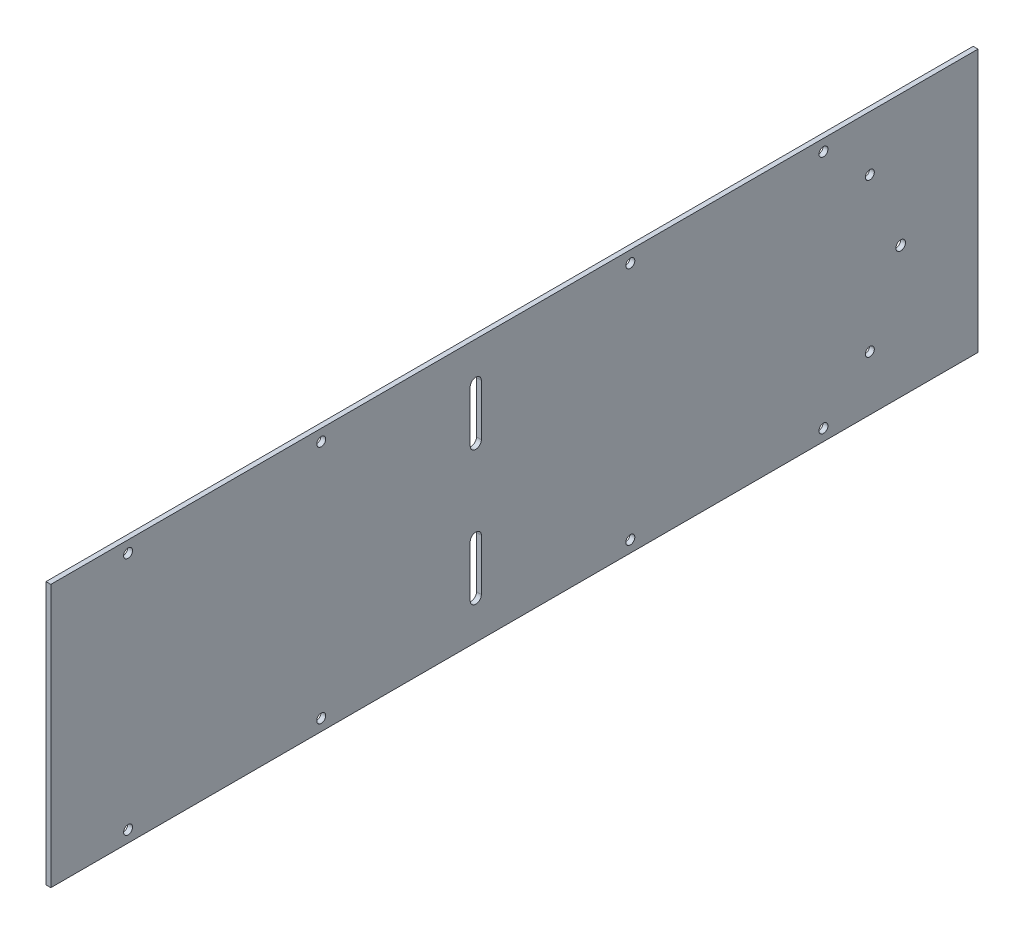
from build123d import *

# Parameters (mm, degrees)
SKETCH1_W                     = 304.8
SKETCH1_H                     = 86.36
BOSS_EXTRUDE1_DEPTH           = 1.5875
F_4_CLEARANCE_HOLE1_OUTLINE_R = 1.4732
F_4_CLEARANCE_HOLE1_DEPTH     = 1.5875
F_1_8_0_125_DIAMETER_HOLE1_D  = 3.175
CUT_EXTRUDE1_DEPTH            = 317.802161855


# Read off the part's stored shape, not the designer's step: #4 Clearance Hole1
with BuildPart() as part:
    # Sketch1 → Boss-Extrude1 (new body)
    with BuildSketch(Plane(origin=(0, 0, 0), x_dir=(0, 0, -1), z_dir=(1, 0, 0))):
        with Locations((152.4, 43.18)):
            Rectangle(SKETCH1_W, SKETCH1_H)
    extrude(amount=BOSS_EXTRUDE1_DEPTH)

    # #4 Clearance Hole1 outline → #4 Clearance Hole1 (cut)
    with BuildSketch(Plane.YZ):
        with Locations((68.36, -269.24)):
            Circle(F_4_CLEARANCE_HOLE1_OUTLINE_R)
        with Locations((18, -269.24)):
            Circle(F_4_CLEARANCE_HOLE1_OUTLINE_R)
        with Locations((82.55, -25.4)):
            Circle(F_4_CLEARANCE_HOLE1_OUTLINE_R)
        with Locations((82.55, -88.9)):
            Circle(F_4_CLEARANCE_HOLE1_OUTLINE_R)
        with Locations((82.55, -190.5)):
            Circle(F_4_CLEARANCE_HOLE1_OUTLINE_R)
        with Locations((82.55, -254)):
            Circle(F_4_CLEARANCE_HOLE1_OUTLINE_R)
        with Locations((3.81, -254)):
            Circle(F_4_CLEARANCE_HOLE1_OUTLINE_R)
        with Locations((3.81, -190.5)):
            Circle(F_4_CLEARANCE_HOLE1_OUTLINE_R)
        with Locations((3.81, -88.9)):
            Circle(F_4_CLEARANCE_HOLE1_OUTLINE_R)
        with Locations((3.81, -25.4)):
            Circle(F_4_CLEARANCE_HOLE1_OUTLINE_R)
    extrude(amount=F_4_CLEARANCE_HOLE1_DEPTH, mode=Mode.SUBTRACT)

    # 1/8 (0.125) Diameter Hole1 (through all)
    with Locations(Plane(origin=(1.5875, 0, 0), x_dir=(0, 0, -1), z_dir=(1, 0, 0))):
        with Locations((279.4, 43.18)):
            Hole(F_1_8_0_125_DIAMETER_HOLE1_D / 2)

    # Sketch6 → Cut-Extrude1 (cut, through all)
    with BuildSketch(Plane(origin=(1.5875, 0, 0), x_dir=(0, 0, -1), z_dir=(1, 0, 0))):
        with BuildLine():
            Line((141.5288, 73.66), (141.5288, 56.781492032))
            ThreePointArc((141.5288, 56.781492032), (139.7, 54.952692032), (137.8712, 56.781492032))
            Line((137.8712, 56.781492032), (137.8712, 73.66))
            ThreePointArc((137.8712, 73.66), (139.7, 75.4888), (141.5288, 73.66))
        make_face()
        with BuildLine():
            Line((141.5288, 12.7), (141.5288, 29.578507968))
            ThreePointArc((141.5288, 29.578507968), (139.7, 31.407307968), (137.8712, 29.578507968))
            Line((137.8712, 29.578507968), (137.8712, 12.7))
            ThreePointArc((137.8712, 12.7), (139.7, 10.8712), (141.5288, 12.7))
        make_face()
    extrude(amount=-CUT_EXTRUDE1_DEPTH, mode=Mode.SUBTRACT)


solid = part.part
